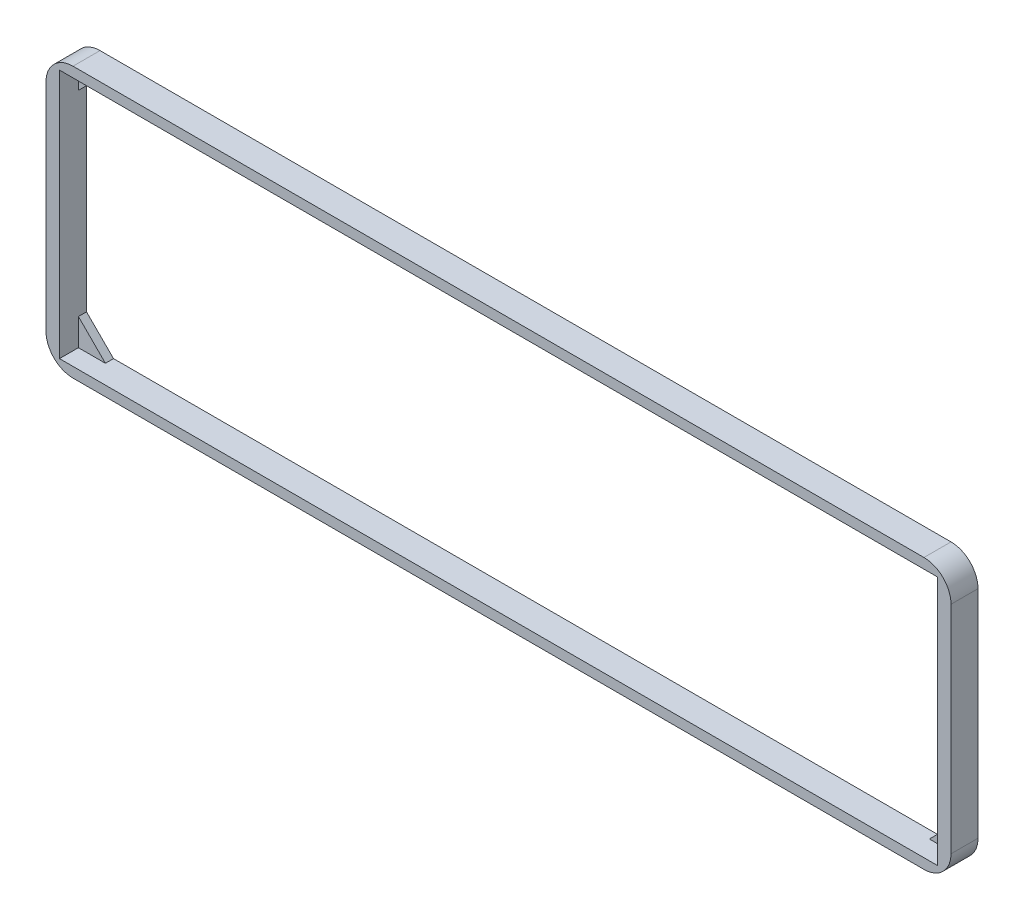
from build123d import *

# Parameters (mm, degrees)
SKETCH1_W           = 335
SKETCH1_H           = 100
SKETCH1_W_2         = 325
SKETCH1_H_2         = 92.5
BOSS_EXTRUDE1_DEPTH = 10
FILLET1_R           = 10
BOSS_EXTRUDE2_DEPTH = 3


with BuildPart() as part:
    # Sketch1 → Boss-Extrude1 (new body)
    with BuildSketch(Plane.XY):
        Rectangle(SKETCH1_W, SKETCH1_H)
        Rectangle(SKETCH1_W_2, SKETCH1_H_2, mode=Mode.SUBTRACT)
    extrude(amount=-BOSS_EXTRUDE1_DEPTH)

    # Fillet1
    fillet1_edges = [part.edges().sort_by_distance(p)[0] for p in [
        (-167.5, 50, -5),
        (-167.5, -50, -5),
        (167.5, -50, -5),
        (167.5, 50, -5),
    ]]
    fillet(fillet1_edges, radius=FILLET1_R)

    # Sketch2 → Boss-Extrude2 (add)
    with BuildSketch(Plane(origin=(0, 0, -10), x_dir=(-1, 0, 0), z_dir=(0, 0, -1))):
        Polygon((-162.5, -46.25), (-162.5, -36.25), (-152.5, -46.25), align=None)
        Polygon((-162.5, 46.25), (-152.5, 46.25), (-162.5, 36.25), align=None)
        Polygon((162.5, 46.25), (152.5, 46.25), (162.5, 36.25), align=None)
        Polygon((162.5, -46.25), (162.5, -36.25), (152.5, -46.25), align=None)
    extrude(amount=-BOSS_EXTRUDE2_DEPTH)


solid = part.part
